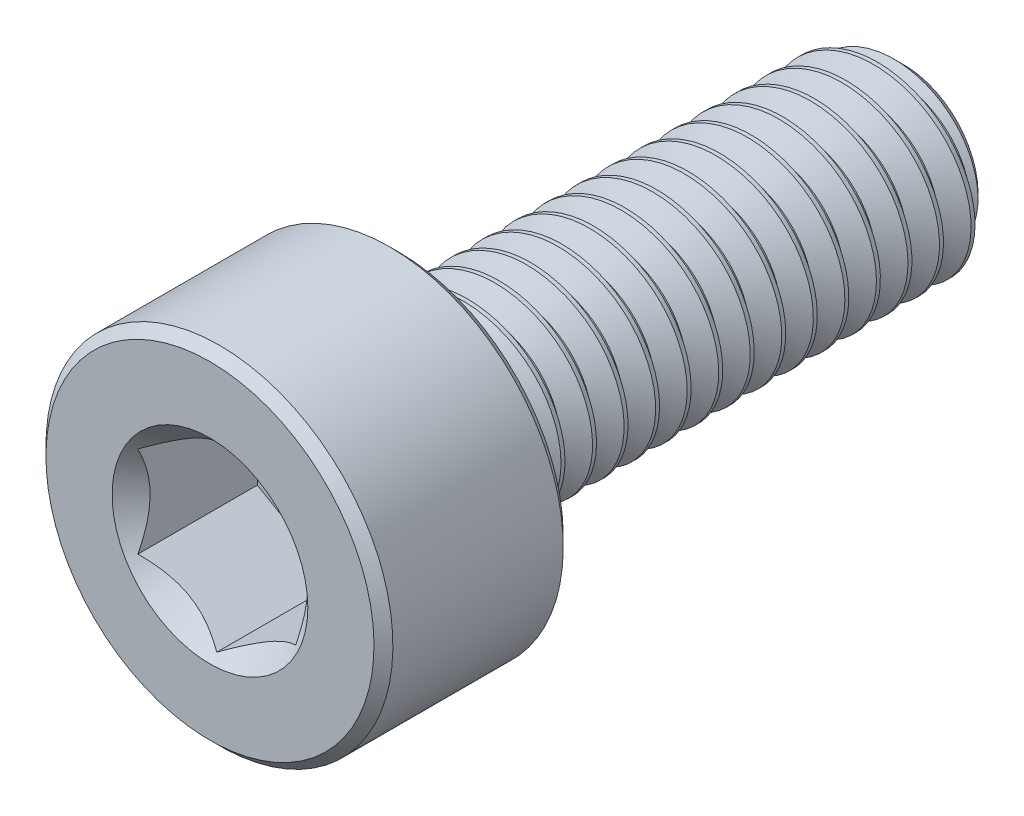
from build123d import *

# Parameters (mm, degrees)
CUT_EXTRUDE1_DEPTH     = 2
SKETCH4_R              = 1.551628848
CUT_EXTRUDE2_DEPTH     = 1.5
CUT_EXTRUDE2_DRAFT     = -45
SPLIT1_SURFACE_1_BACK  = 14.472
SPLIT1_SURFACE_1_DEPTH = 28.944
SPLIT1_SURFACE_2_BACK  = 14.472
SPLIT1_SURFACE_2_DEPTH = 28.944
CUT_SWEEP1_PITCH       = 0.5


with BuildPart() as part:
    # Sketch2 → Revolve1 (revolve)
    with BuildSketch(Plane(origin=(0, 0, 0), x_dir=(0, 0, -1), z_dir=(1, 0, 0))):
        with BuildLine():
            Line((-5.5, 0), (-5.5, 2.6))
            Line((-5.5, 2.6), (-5.35, 2.75))
            Line((-5.35, 2.75), (-2.65, 2.75))
            Line((-2.65, 2.75), (-2.5, 2.6))
            Line((-2.5, 2.6), (-2.5, 1.65))
            ThreePointArc((-2.5, 1.65), (-2.456066017, 1.543933983), (-2.35, 1.5))
            Line((-2.35, 1.5), (5.175240474, 1.5))
            Line((5.175240474, 1.5), (5.5, 1.175240474))
            Line((5.5, 1.175240474), (5.5, 0))
            Line((5.5, 0), (-5.5, 0))
        make_face()
    revolve(axis=Axis((0, 0, -5.5), (0, 0, 1)))

    # Sketch3 → Cut-Extrude1 (cut)
    with BuildSketch(Plane.XY.offset(5.5)):
        Polygon((1.25, -0.721687836), (1.25, 0.721687836), (0, 1.443375673), (-1.25, 0.721687836), (-1.25, -0.721687836), (0, -1.443375673), align=None)
    extrude(amount=-CUT_EXTRUDE1_DEPTH, mode=Mode.SUBTRACT)


with BuildPart() as cut_extrude2_tool:
    # Sketch4 → Cut-Extrude2 (with draft: the straight prism first)
    with BuildSketch(Plane.XY.offset(5.5)):
        Circle(SKETCH4_R)
    extrude(amount=-CUT_EXTRUDE2_DEPTH)
    # Cut-Extrude2: the draft: its side faces are tilted about the plane it starts from
    cut_extrude2_sides = [cut_extrude2_tool.faces().sort_by_distance(p)[0] for p in [
        (-1.551628848, 0, 4.75),
    ]]
    draft(cut_extrude2_sides, Plane.XY.offset(5.5), CUT_EXTRUDE2_DRAFT)


with BuildPart() as part_1:
    add(part.part)

    # Cut-Extrude2: cut by cut_extrude2_tool
    add(cut_extrude2_tool.part, mode=Mode.SUBTRACT)


with BuildPart() as body_2:
    # Split1: the piece behind the surface
    add(part_1.part)
    # Split1 surface: a surface, the sketch's curves swept straight by 28.944 mm
    with BuildLine(Plane(origin=(0, 0, 0), x_dir=(0, 0, -1), z_dir=(1, 0, 0)).offset(-SPLIT1_SURFACE_1_BACK), mode=Mode.PRIVATE) as split1_surface_1_path:
        Line((-2.35, -2.75), (-2.35, 2.75))
    split1_surface_1 = Shell.extrude(split1_surface_1_path.wire(), (1 * SPLIT1_SURFACE_1_DEPTH, 0 * SPLIT1_SURFACE_1_DEPTH, 0 * SPLIT1_SURFACE_1_DEPTH))
    split(bisect_by=split1_surface_1, keep=Keep.BOTTOM)

    # Cut-Sweep1: the profile of Sketch7 screwed along a right-hand helix of 17 turns, 6 arcs to a turn; built about Z, then put on its axis
    cut_sweep1_z = Axis((0, 0, 0), (0, 0, 1))
    cut_sweep1_corners = [(1.527063294, 0, 0.015625), (1.527063294, 0, -0.453125), (1.175240474, 0, -0.25), (1.175240474, 0, -0.1875)]
    with BuildLine(mode=Mode.PRIVATE) as cut_sweep1_profile:
        Line(cut_sweep1_corners[0], cut_sweep1_corners[1])
        Line(cut_sweep1_corners[1], cut_sweep1_corners[2])
        Line(cut_sweep1_corners[2], cut_sweep1_corners[3])
        Line(cut_sweep1_corners[3], cut_sweep1_corners[0])
    cut_sweep1_cap = Face(cut_sweep1_profile.wire())
    cut_sweep1_turn_angles = [0, 30, 60, 90, 120, 150, 180, 210, 240, 270, 300, 330, 360]
    cut_sweep1_turn_weights = [1, 0.8660254037844387, 1, 0.8660254037844387, 1, 0.8660254037844387, 1, 0.8660254037844387, 1, 0.8660254037844387, 1, 0.8660254037844387, 1]
    cut_sweep1_turn_rails = [Edge.make_bspline([Vector(p[0], p[1], 0).rotate(cut_sweep1_z, cut_sweep1_turn_angles[k]) / cut_sweep1_turn_weights[k] + Vector(0, 0, p[2] + CUT_SWEEP1_PITCH * cut_sweep1_turn_angles[k] / 360) for k in range(13)], [0, 0, 0, 1, 1, 2, 2, 3, 3, 4, 4, 5, 5, 6, 6, 6], 2, cut_sweep1_turn_weights) for p in cut_sweep1_corners]
    cut_sweep1_turn_sides = [Face.make_surface_from_curves(cut_sweep1_turn_rails[p[0]], cut_sweep1_turn_rails[p[1]]) for p in [(0, 1), (1, 2), (2, 3), (3, 0)]]
    cut_sweep1 = Plane(origin=(0, 0, -5.5), x_dir=(0, 1, 0), z_dir=(0, 0, 1)) * Solid(Shell([*[p.moved(Location((0, 0, CUT_SWEEP1_PITCH * i))) for i in range(17) for p in cut_sweep1_turn_sides], cut_sweep1_cap, cut_sweep1_cap.rotate(cut_sweep1_z, 6120).moved(Location((0, 0, CUT_SWEEP1_PITCH * 6120 / 360)))]))
    add(cut_sweep1, mode=Mode.SUBTRACT)


with BuildPart() as part_2:
    add(part_1.part)

    # Split1: split by a surface, the side it looks to stays
    # Split1 surface: a surface, the sketch's curves swept straight by 28.944 mm
    with BuildLine(Plane(origin=(0, 0, 0), x_dir=(0, 0, -1), z_dir=(1, 0, 0)).offset(-SPLIT1_SURFACE_2_BACK), mode=Mode.PRIVATE) as split1_surface_2_path:
        Line((-2.35, -2.75), (-2.35, 2.75))
    split1_surface_2 = Shell.extrude(split1_surface_2_path.wire(), (1 * SPLIT1_SURFACE_2_DEPTH, 0 * SPLIT1_SURFACE_2_DEPTH, 0 * SPLIT1_SURFACE_2_DEPTH))
    split(bisect_by=split1_surface_2, keep=Keep.TOP)

    add(body_2.part)  # Revolve2 merges body 2
    # Sketch8 → Revolve2 (revolve)
    with BuildSketch(Plane(origin=(0, 0, 0), x_dir=(0, 0, -1), z_dir=(1, 0, 0))):
        Polygon((-2.5, 0), (-2.5, 1.5), (-2.35, 1.5), (-1.483974596, 0), align=None)
    revolve(axis=Axis((0, 0, 1.483974596), (0, 0, 1)))


solid = part_2.part
